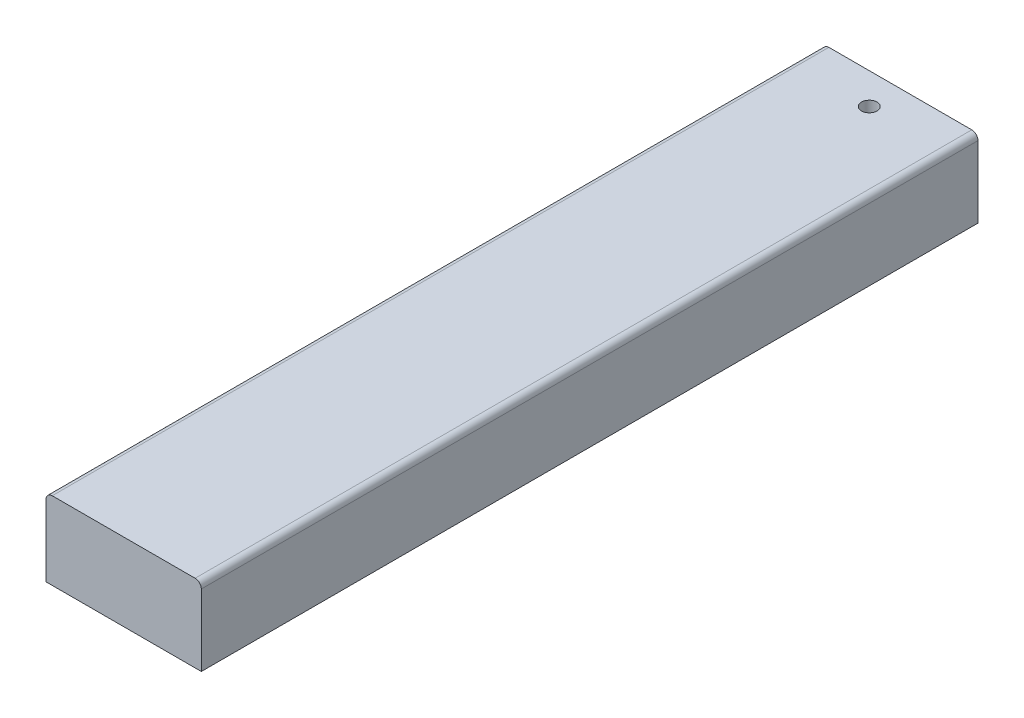
from build123d import *

# Parameters (mm, degrees)
SKETCH1_W               = 50
SKETCH1_H               = 20
BOSS_EXTRUDE1_DEPTH     = 125
SKETCH3_W               = 50
SKETCH3_H               = 250
BOSS_EXTRUDE2_DEPTH     = 5
CUT_EXTRUDE1_DEPTH      = 130.903810568
CUT_EXTRUDE1_DEPTH_BACK = 10
SKETCH2_R               = 2.5
FILLET1_R               = 2
SKETCH4_R               = 7.874
CUT_EXTRUDE2_DEPTH      = 10


with BuildPart() as part:
    # Sketch1 → Boss-Extrude1 (new, symmetric)
    with BuildSketch(Plane.XY):
        Rectangle(SKETCH1_W, SKETCH1_H)
    extrude(amount=BOSS_EXTRUDE1_DEPTH, both=True)

    # Sketch3 → Boss-Extrude2 (add)
    with BuildSketch(Plane(origin=(0, 10, 0), x_dir=(1, 0, 0), z_dir=(0, 1, 0))):
        Rectangle(SKETCH3_W, SKETCH3_H)
    extrude(amount=BOSS_EXTRUDE2_DEPTH)

    # Sketch2 → Cut-Extrude1 (cut, two sides: drawn at the far end of the back side and taken through both)
    with BuildSketch(Plane(origin=(0, 15, 0), x_dir=(1, 0, 0), z_dir=(0, 1, 0)).offset(-CUT_EXTRUDE1_DEPTH_BACK)):
        with Locations((0, 115)):
            Circle(SKETCH2_R)
    extrude(amount=CUT_EXTRUDE1_DEPTH + CUT_EXTRUDE1_DEPTH_BACK, mode=Mode.SUBTRACT)

    # Fillet1
    fillet1_edges = [part.edges().sort_by_distance(p)[0] for p in [
        (-25, 15, 0),
        (25, 15, 0),
    ]]
    fillet(fillet1_edges, radius=FILLET1_R)

    # Sketch4 → Cut-Extrude2 (cut)
    with BuildSketch(Plane.XZ.offset(10)):
        with Locations((0, 110)):
            Circle(SKETCH4_R)
    extrude(amount=-CUT_EXTRUDE2_DEPTH, mode=Mode.SUBTRACT)


solid = part.part
